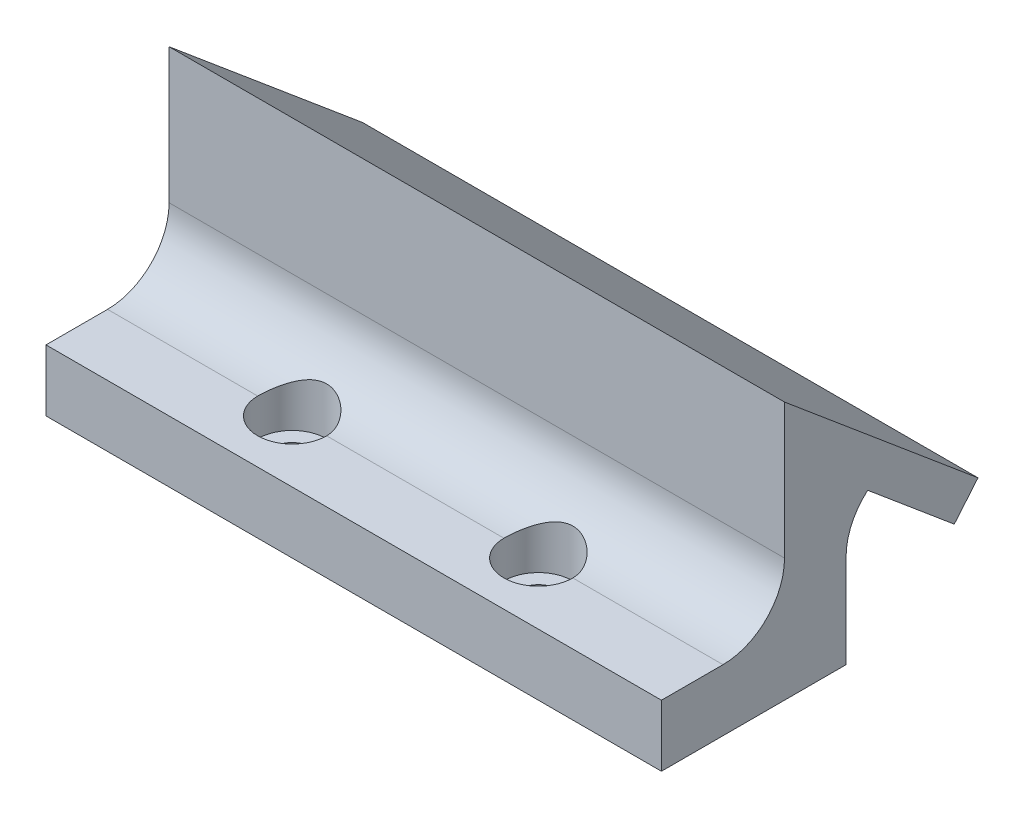
from build123d import *

# Parameters (mm, degrees)
CROQUIS1_W              = 30
CROQUIS1_H              = 10
CROQUIS1_R              = 1.6
SALIENTE_EXTRUIR1_DEPTH = 5
CROQUIS2_R              = 2.8
CORTAR_EXTRUIR1_DEPTH   = 3
SALIENTE_EXTRUIR5_DEPTH = 10
SALIENTE_EXTRUIR6_DEPTH = 30
SALIENTE_EXTRUIR7_DEPTH = 10
REDONDEO1_R             = 5
REDONDEO2_R             = 5
SALIENTE_EXTRUIR8_DEPTH = 50


# Some blends are built 0.0001 mm under size
with BuildPart() as part:
    # Croquis1 → Saliente-Extruir1 (new body)
    with BuildSketch(Plane(origin=(0, 0, 0), x_dir=(1, 0, 0), z_dir=(0, 1, 0))):
        with Locations((15, 5)):
            Rectangle(CROQUIS1_W, CROQUIS1_H)
        with Locations(Location((5, 5, 0), (0, 0, 270))):
            Circle(CROQUIS1_R, mode=Mode.SUBTRACT)
        with Locations(Location((25, 5, 0), (0, 0, 270))):
            Circle(CROQUIS1_R, mode=Mode.SUBTRACT)
    extrude(amount=SALIENTE_EXTRUIR1_DEPTH)

    # Croquis2 → Cortar-Extruir1 (cut)
    with BuildSketch(Plane(origin=(0, 5, 0), x_dir=(1, 0, 0), z_dir=(0, 1, 0))):
        with Locations(Location((5, 5, 0), (0, 0, 270))):
            Circle(CROQUIS2_R)
        with Locations(Location((25, 5, 0), (0, 0, 270))):
            Circle(CROQUIS2_R)
    extrude(amount=-CORTAR_EXTRUIR1_DEPTH, mode=Mode.SUBTRACT)

    # Croquis6 → Saliente-Extruir5 (add)
    with BuildSketch(Plane.ZY):
        Polygon((-15, 16.781992624), (-10, 20.977490779), (-10, 16.781992624), (-10, 5), (0, 5), (0, 0), (-10, 0), (-15, 0), (-15, 12.586494468), (-20, 12.586494468), align=None)
    extrude(amount=SALIENTE_EXTRUIR5_DEPTH)

    # Croquis7 → Saliente-Extruir6 (add)
    with BuildSketch(Plane(origin=(0, 0, 0), x_dir=(0, 0, -1), z_dir=(1, 0, 0))):
        Polygon((10, 20.977490779), (10, 5), (10, 0), (15, 0), (15, 12.586494468), (20, 12.586494468), align=None)
    extrude(amount=SALIENTE_EXTRUIR6_DEPTH)

    # Croquis8 → Saliente-Extruir7 (add)
    with BuildSketch(Plane(origin=(30, 0, 0), x_dir=(0, 0, -1), z_dir=(1, 0, 0))):
        Polygon((0, 0), (15, 0), (15, 12.586494468), (20, 12.586494468), (10, 20.977490779), (10, 5), (0, 5), align=None)
    extrude(amount=SALIENTE_EXTRUIR7_DEPTH)

    # Redondeo1
    # the kernel refuses this fillet: 5 mm, written as the material it adds along each edge
    with BuildSketch(Plane(origin=(40, 5, -10), x_dir=(0, 1, 0), z_dir=(-1, 0, 0))) as redondeo1_piece_1_section:
        with BuildLine():
            CenterArc((REDONDEO1_R, -REDONDEO1_R), REDONDEO1_R, 90, 90)
            Line((0, -REDONDEO1_R), (0, 0))
            Line((0, 0), (REDONDEO1_R, 0))
        make_face()
    redondeo1_piece_1 = extrude(amount=50, mode=Mode.PRIVATE)
    redondeo1_piece_1 = redondeo1_piece_1 - Plane(origin=(5, 6.156265405, -5), x_dir=(0, 0, 1), z_dir=(0, 1, 0)) * Cylinder(2.8, 120, mode=Mode.PRIVATE)
    redondeo1_piece_1 = redondeo1_piece_1 - Plane(origin=(25, 6.156265405, -5), x_dir=(0, 0, 1), z_dir=(0, 1, 0)) * Cylinder(2.8, 120, mode=Mode.PRIVATE)
    add(redondeo1_piece_1)

    # Redondeo2
    redondeo2_edges = [part.edges().sort_by_distance(p)[0] for p in [
        (15, 12.586494468, -15),
    ]]
    fillet(redondeo2_edges, radius=REDONDEO2_R - 0.0001)  # a hair under: the kernel refuses the full size

    # Croquis9 → Saliente-Extruir8 (add)
    with BuildSketch(Plane.ZY.offset(10)):
        Polygon((-20, 12.586494468), (-25.717162805, 7.789225266), (-23.788799976, 5.491091937), (-10, 17.061268911), (-10, 20.977490779), align=None)
    extrude(amount=-SALIENTE_EXTRUIR8_DEPTH)


solid = part.part
